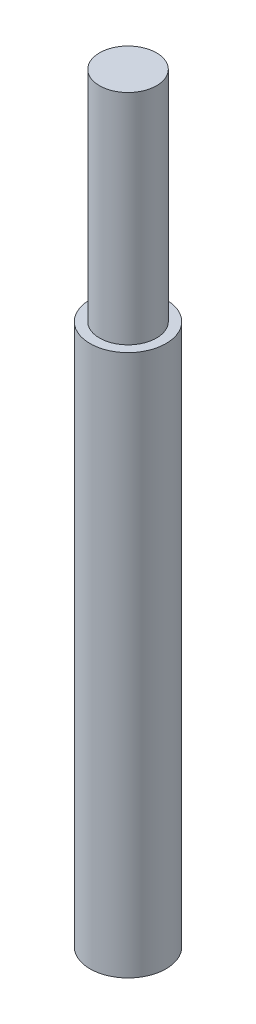
from build123d import *

# Parameters (mm, degrees)
SKETCH1_R           = 4
BOSS_EXTRUDE1_DEPTH = 57
SKETCH2_R           = 3
BOSS_EXTRUDE2_DEPTH = 23


with BuildPart() as part:
    # Sketch1 → Boss-Extrude1 (new body)
    with BuildSketch(Plane(origin=(0, 0, 0), x_dir=(1, 0, 0), z_dir=(0, 1, 0))):
        Circle(SKETCH1_R)
    extrude(amount=BOSS_EXTRUDE1_DEPTH)

    # Sketch2 → Boss-Extrude2 (add)
    with BuildSketch(Plane(origin=(0, 57, 0), x_dir=(1, 0, 0), z_dir=(0, 1, 0))):
        Circle(SKETCH2_R)
    extrude(amount=BOSS_EXTRUDE2_DEPTH)


solid = part.part
